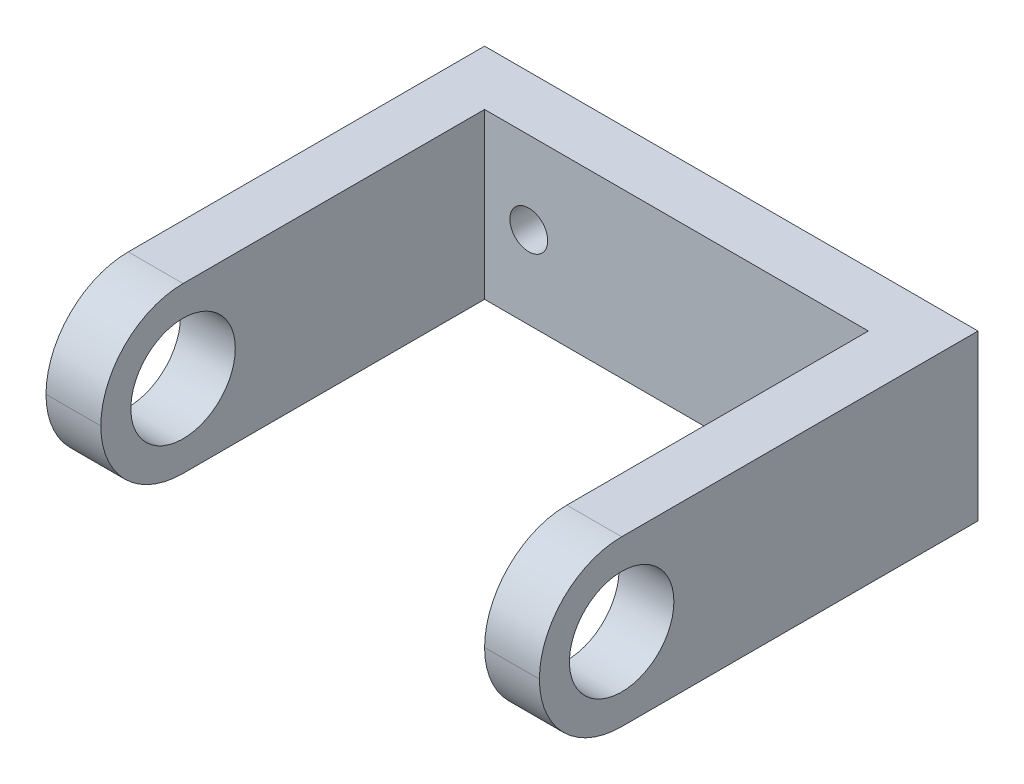
from build123d import *

# Parameters (mm, degrees)
BOSS_EXTRUDE1_DEPTH     = 7.5
CUT_EXTRUDE1_DEPTH      = 41.233692349
CUT_EXTRUDE1_DEPTH_BACK = 41.233692349
SKETCH3_R               = 4.7625
FILLET1_R               = 7.5
F_8_32_TAPPED_HOLE1_D   = 3.4544


with BuildPart() as part:
    # Sketch1 → Boss-Extrude1 (new, symmetric)
    with BuildSketch(Plane(origin=(0, 0, 0), x_dir=(1, 0, 0), z_dir=(0, 1, 0))):
        Polygon((-17.5, -7.5), (-22.5, -7.5), (-22.5, 32.5), (22.5, 32.5), (22.5, -7.5), (17.5, -7.5), (17.5, 27.5), (-17.5, 27.5), align=None)
    extrude(amount=BOSS_EXTRUDE1_DEPTH, both=True)

    # Sketch3 → Cut-Extrude1 (cut, two sides: drawn at the far end of the back side and taken through both)
    with BuildSketch(Plane(origin=(0, 0, 0), x_dir=(0, 0, -1), z_dir=(1, 0, 0)).offset(-CUT_EXTRUDE1_DEPTH_BACK)):
        Circle(SKETCH3_R)
    extrude(amount=CUT_EXTRUDE1_DEPTH + CUT_EXTRUDE1_DEPTH_BACK, mode=Mode.SUBTRACT)

    # Fillet1
    fillet1_edges = [part.edges().sort_by_distance(p)[0] for p in [
        (20, 7.5, 7.5),
        (20, -7.5, 7.5),
        (-20, -7.5, 7.5),
        (-20, 7.5, 7.5),
    ]]
    fillet(fillet1_edges, radius=FILLET1_R - 0.0001)  # a hair under: the kernel refuses the full size

    # #8-32 Tapped Hole1 (through all)
    with Locations(Plane.XY.offset(-27.5)):
        with Locations((-13.47, 0)):
            Hole(F_8_32_TAPPED_HOLE1_D / 2)


solid = part.part
